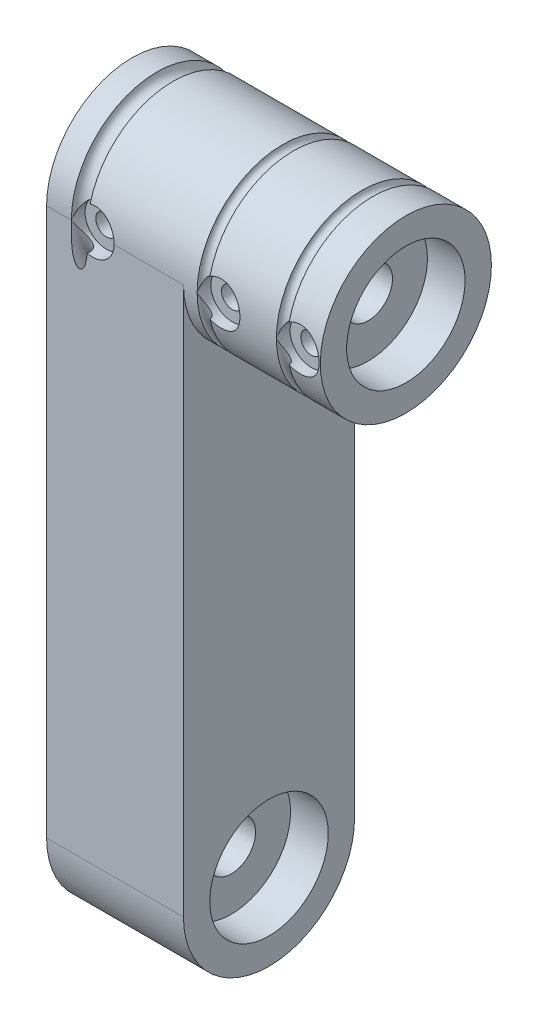
from build123d import *
from build123d.topology import SkipClean

# Parameters (mm, degrees)
SKETCH1_R           = 4.5
BOSS_EXTRUDE1_DEPTH = 25.4
SKETCH2_R           = 15.875
SKETCH2_R_2         = 4.5
BOSS_EXTRUDE2_DEPTH = 25.4
SKETCH5_R           = 3.96875
CUT_EXTRUDE1_DEPTH  = 6.35
BOSS_EXTRUDE3_START = 3.81
SKETCH7_R           = 3.96875
SKETCH7_R_2         = 1.984375
BOSS_EXTRUDE3_DEPTH = 3.81
SKETCH14_R          = 10.99185
CUT_EXTRUDE4_DEPTH  = 6.985
SKETCH16_R          = 10.99185
CUT_EXTRUDE5_DEPTH  = 6.985
SKETCH19_R          = 1.5
SKETCH20_R          = 3.96875
CUT_EXTRUDE6_DEPTH  = 6.35
BOSS_EXTRUDE4_START = 3.81
SKETCH21_R          = 3.96875
SKETCH21_R_2        = 1.984375
BOSS_EXTRUDE4_DEPTH = 3.81
CUT_EXTRUDE2_START  = -6.985
SKETCH12_R          = 10.99185
CUT_EXTRUDE2_DEPTH  = 6.985


with BuildPart() as part:
    # Sketch1 → Boss-Extrude1 (new body)
    with BuildSketch(Plane(origin=(0, 0, 0), x_dir=(0, 0, -1), z_dir=(1, 0, 0))):
        with BuildLine():
            Line((15.875, 50.8), (15.875, -50.8))
            ThreePointArc((15.875, -50.8), (0, -66.675), (-15.875, -50.8))
            Line((-15.875, -50.8), (-15.875, 50.8))
            ThreePointArc((-15.875, 50.8), (0, 66.675), (15.875, 50.8))
        make_face()
        with Locations((0, -50.8)):
            Circle(SKETCH1_R, mode=Mode.SUBTRACT)
        with Locations((0, 50.8)):
            Circle(SKETCH1_R, mode=Mode.SUBTRACT)
    extrude(amount=BOSS_EXTRUDE1_DEPTH)

    # Sketch2 → Boss-Extrude2 (add)
    with SkipClean():  # the faces are left unmerged after this step: merging them gives an invalid solid
        with BuildSketch(Plane(origin=(25.4, 0, 0), x_dir=(0, 0, -1), z_dir=(1, 0, 0))):
            with Locations((0, 50.8)):
                Circle(SKETCH2_R)
            with Locations((0, 50.8)):
                Circle(SKETCH2_R_2, mode=Mode.SUBTRACT)
        extrude(amount=BOSS_EXTRUDE2_DEPTH)
    add(part.part.scale(1), mode=Mode.REPLACE)  # the faces are merged on a copy

    # Sketch3 → Cut-Revolve1 (revolve, cut)
    with BuildSketch(Plane.XY):
        with BuildLine():
            Line((27.94, 66.675), (29.94, 66.675))
            ThreePointArc((29.94, 66.675), (28.94, 65.675), (27.94, 66.675))
        make_face()
        with BuildLine():
            Line((42.64, 66.675), (44.64, 66.675))
            ThreePointArc((44.64, 66.675), (43.64, 65.675), (42.64, 66.675))
        make_face()
    revolve(axis=Axis((45.661298308, 50.8, 0), (-1, 0, 0)), mode=Mode.SUBTRACT)

    # Sketch5 → Cut-Extrude1 (cut)
    with BuildSketch(Plane.XY.offset(15.875)):
        with Locations((31.90875, 50.8)):
            Circle(SKETCH5_R)
        with Locations((46.60875, 50.8)):
            Circle(SKETCH5_R)
    extrude(amount=-CUT_EXTRUDE1_DEPTH, mode=Mode.SUBTRACT)

    # Sketch7 → Boss-Extrude3 (add)
    # profile 1 of 2: a face of its own
    with BuildSketch(Plane.XY.offset(9.525).offset(BOSS_EXTRUDE3_START)):
        with Locations((31.90875, 50.8)):
            Circle(SKETCH7_R)
        with Locations((31.90875, 50.8)):
            Circle(SKETCH7_R_2, mode=Mode.SUBTRACT)
    # profile 2 of 2: a face of its own
    with BuildSketch(Plane.XY.offset(9.525).offset(BOSS_EXTRUDE3_START)):
        with Locations((46.60875, 50.8)):
            Circle(SKETCH7_R)
        with Locations((46.60875, 50.8)):
            Circle(SKETCH7_R_2, mode=Mode.SUBTRACT)
    extrude(amount=-BOSS_EXTRUDE3_DEPTH)

    # Sketch14 → Cut-Extrude4 (cut)
    with BuildSketch(Plane(origin=(25.4, 0, 0), x_dir=(0, 0, -1), z_dir=(1, 0, 0))):
        with Locations((0, -50.8)):
            Circle(SKETCH14_R)
    extrude(amount=-CUT_EXTRUDE4_DEPTH, mode=Mode.SUBTRACT)

    # Sketch16 → Cut-Extrude5 (cut)
    with BuildSketch(Plane(origin=(50.8, 0, 0), x_dir=(0, 0, -1), z_dir=(1, 0, 0))):
        with Locations((0, 50.8)):
            Circle(SKETCH16_R)
    extrude(amount=-CUT_EXTRUDE5_DEPTH, mode=Mode.SUBTRACT)

    # Sketch19 → Cut-Revolve2 (revolve, cut)
    with BuildSketch(Plane.XY):
        with Locations((6.096, 66.675)):
            Circle(SKETCH19_R)
    revolve(axis=Axis((0, 50.8, 0), (1, 0, 0)), mode=Mode.SUBTRACT)

    # Sketch20 → Cut-Extrude6 (cut)
    with BuildSketch(Plane.XY.offset(15.875)):
        with Locations((8.56475, 50.8)):
            Circle(SKETCH20_R)
    extrude(amount=-CUT_EXTRUDE6_DEPTH, mode=Mode.SUBTRACT)

    # Sketch21 → Boss-Extrude4 (add)
    with BuildSketch(Plane.XY.offset(9.525).offset(BOSS_EXTRUDE4_START)):
        with Locations((8.56475, 50.8)):
            Circle(SKETCH21_R)
        with Locations((8.56475, 50.8)):
            Circle(SKETCH21_R_2, mode=Mode.SUBTRACT)
    extrude(amount=-BOSS_EXTRUDE4_DEPTH)

    # Sketch12 → Cut-Extrude2 (cut)
    with BuildSketch(Plane.ZY.offset(CUT_EXTRUDE2_START)):
        with Locations((0, 50.8)):
            Circle(SKETCH12_R)
        with Locations((0, -50.8)):
            Circle(SKETCH12_R)
    extrude(amount=CUT_EXTRUDE2_DEPTH, mode=Mode.SUBTRACT)


solid = part.part
